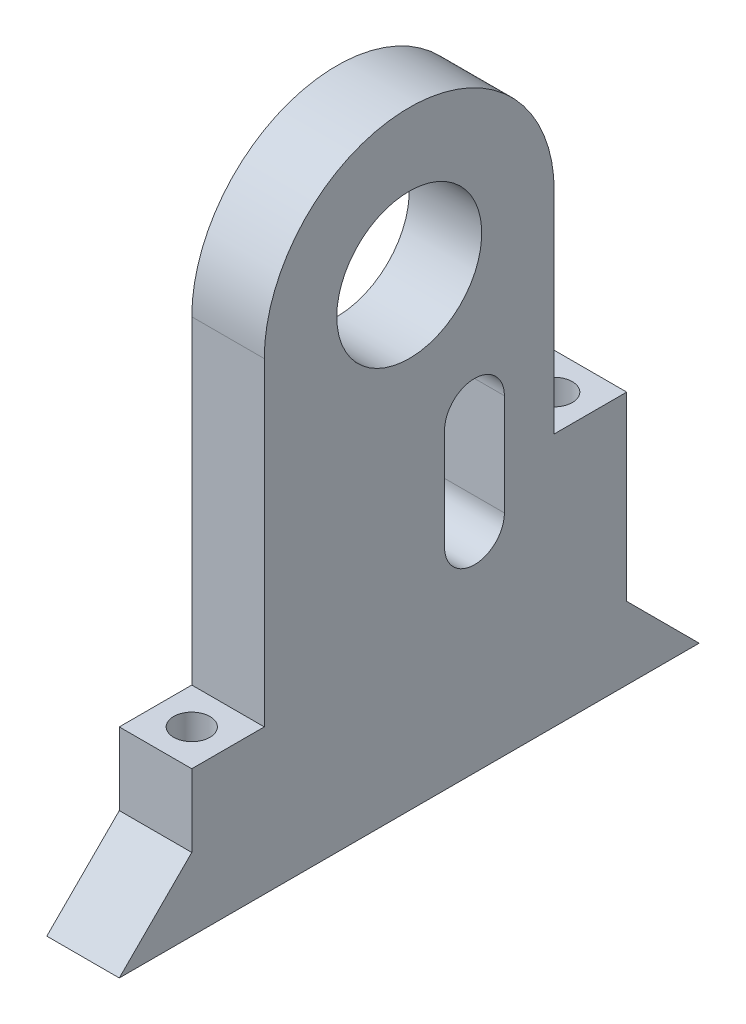
from build123d import *

# Parameters (mm, degrees)
BOSS_EXTRUDE1_DEPTH        = 5
F_10_0MM_DOWEL_HOLE1_D     = 10
F_10_0MM_DOWEL_HOLE1_DEPTH = 25
F_10_0MM_DOWEL_HOLE1_TIP   = 3.004303095
CUT_EXTRUDE1_DEPTH         = 10
M3_TAPPED_HOLE1_AT_2_COUNT = 2
M3_TAPPED_HOLE1_AT_2_PITCH = 25
M3_TAPPED_HOLE2_D          = 2.5
M3_TAPPED_HOLE2_DEPTH      = 17.5
M3_TAPPED_HOLE2_TIP        = 0.751075774


with BuildPart() as part:
    # Sketch1 → Boss-Extrude1 (new body)
    with BuildSketch(Plane(origin=(0, 0, 0), x_dir=(0, 0, -1), z_dir=(1, 0, 0))):
        with BuildLine():
            Line((10, 0), (-10, 0))
            Line((-10, 0), (-20, 0))
            Line((-20, 0), (-15, 5))
            Line((-15, 5), (-15, 10))
            Line((-15, 10), (-10, 10))
            Line((-10, 10), (-10, 32))
            ThreePointArc((-10, 32), (0, 42), (10, 32))
            Line((10, 32), (10, 17.5))
            Line((10, 17.5), (15, 17.5))
            Line((15, 17.5), (15, 10))
            Line((15, 10), (15, 5))
            Line((15, 5), (20, 0))
            Line((20, 0), (10, 0))
        make_face()
    extrude(amount=BOSS_EXTRUDE1_DEPTH)

    # Ø10.0mm Dowel Hole1
    with Locations(Plane(origin=(0, 32, 0), x_dir=(0, 0, -1), z_dir=(-1, 0, 0))):
        with Locations((0, 0)):
            Hole(F_10_0MM_DOWEL_HOLE1_D / 2, depth=F_10_0MM_DOWEL_HOLE1_DEPTH)
            with Locations((0, 0, -(F_10_0MM_DOWEL_HOLE1_DEPTH + F_10_0MM_DOWEL_HOLE1_TIP / 2))):  # 118° drill point
                Cone(0, F_10_0MM_DOWEL_HOLE1_D / 2, F_10_0MM_DOWEL_HOLE1_TIP, mode=Mode.SUBTRACT)

    # Sketch5 → Cut-Extrude1 (cut)
    with BuildSketch(Plane(origin=(5, 0, 0), x_dir=(0, 0, -1), z_dir=(1, 0, 0))):
        with BuildLine():
            Line((6.563643286, 21.5), (6.563643286, 14.5))
            ThreePointArc((6.563643286, 14.5), (4.5, 12.436356714), (2.436356714, 14.5))
            Line((2.436356714, 14.5), (2.436356714, 21.5))
            ThreePointArc((2.436356714, 21.5), (4.5, 23.563643286), (6.563643286, 21.5))
        make_face()
    extrude(amount=-CUT_EXTRUDE1_DEPTH, mode=Mode.SUBTRACT)

    # Sketch9 → M3 Tapped Hole1 (revolve, cut)
    with BuildSketch(Plane(origin=(2.5, 10, 12.5), x_dir=(0, 0, 1), z_dir=(1, 0, 0))):
        Polygon((0, 0), (0, 18.251075774), (1.25, 17.5), (1.25, 0), align=None)
    m3_tapped_hole1 = revolve(axis=Axis((2.5, 16.35, 12.5), (0, -1, 0)), mode=Mode.SUBTRACT)

    # M3 Tapped Hole1 at 2: M3 Tapped Hole1 ×2
    with Locations(*[(0, 0, -i * M3_TAPPED_HOLE1_AT_2_PITCH) for i in range(1, M3_TAPPED_HOLE1_AT_2_COUNT)]):
        add(m3_tapped_hole1, mode=Mode.SUBTRACT)

    # M3 Tapped Hole2
    with Locations(Plane(origin=(0, 17.5, 0), x_dir=(1, 0, 0), z_dir=(0, 1, 0))):
        with Locations((2.5, 12.5)):
            Hole(M3_TAPPED_HOLE2_D / 2, depth=M3_TAPPED_HOLE2_DEPTH)
            with Locations((0, 0, -(M3_TAPPED_HOLE2_DEPTH + M3_TAPPED_HOLE2_TIP / 2))):  # 118° drill point
                Cone(0, M3_TAPPED_HOLE2_D / 2, M3_TAPPED_HOLE2_TIP, mode=Mode.SUBTRACT)


solid = part.part
